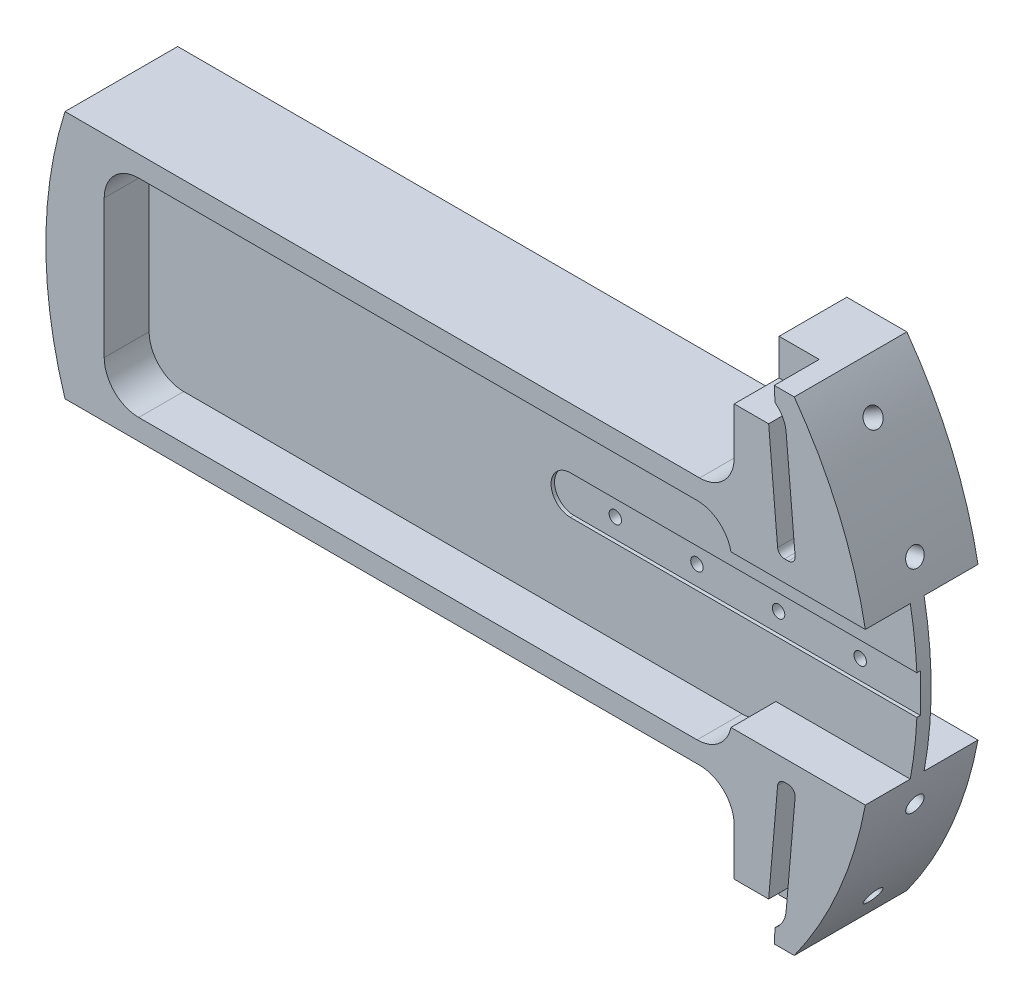
from build123d import *

# Parameters (mm, degrees)
BOSS_EXTRUDE1_DEPTH  = 2.54
BOSS_EXTRUDE2_DEPTH  = 8.255
SKETCH3_W            = 64.77
SKETCH3_H            = 7.1
CUT_EXTRUDE1_DEPTH   = 0.635
SKETCH4_R            = 1.143
CUT_EXTRUDE2_DEPTH   = 11.43
BOSS_EXTRUDE5_DEPTH  = 8.255
BOSS_EXTRUDE6_DEPTH  = 8.255
BOSS_EXTRUDE7_START  = -8.255
BOSS_EXTRUDE7_DEPTH  = 8.255
SKETCH39_W           = 13.975397925
SKETCH39_H           = 27.94
CUT_EXTRUDE19_DEPTH  = 8.255
FILLET2_R            = 1.27
SKETCH45_W           = 121.797556925
SKETCH45_H           = 2.54
BOSS_EXTRUDE8_DEPTH  = 10.795
SKETCH46_W           = 115.173424181
SKETCH46_H           = 40.351825118
CUT_EXTRUDE20_DEPTH  = 8.255
SKETCH48_W           = 115.173424181
SKETCH48_H           = 6.205912559
BOSS_EXTRUDE9_DEPTH  = 2.54
CUT_EXTRUDE24_DEPTH  = 43.688
CUT_EXTRUDE25_DEPTH  = 0.635
SKETCH53_W           = 13.339244652
SKETCH53_H           = 4.785328469
CUT_EXTRUDE26_DEPTH  = 43.688
BOSS_EXTRUDE10_REACH = 90.657
FILLET8_R            = 6.35
BOSS_EXTRUDE13_START = -20.701
BOSS_EXTRUDE13_DEPTH = 9.906
SKETCH63_R           = 1.651
CUT_EXTRUDE30_DEPTH  = 7.62
SKETCH64_R           = 1.651
CUT_EXTRUDE31_DEPTH  = 10.16
SKETCH65_R           = 1.651
CUT_EXTRUDE32_DEPTH  = 10.16
SKETCH66_R           = 1.651
CUT_EXTRUDE33_DEPTH  = 8.89
SKETCH67_R           = 1.651
CUT_EXTRUDE34_DEPTH  = 8.89


with BuildPart() as part:
    # Sketch1 → Boss-Extrude1 (new body)
    with BuildSketch(Plane.XY):
        with BuildLine():
            Line((-71.572584947, 25.4), (-65.222584947, 25.4))
            Line((-65.222584947, 25.4), (-65.222584947, 22.86))
            ThreePointArc((-65.222584947, 22.86), (-63.362713008, 18.369871939), (-58.872584947, 16.51))
            Line((-58.872584947, 16.51), (44.196, 16.51))
            ThreePointArc((44.196, 16.51), (48.686128061, 18.369871939), (50.546, 22.86))
            Line((50.546, 22.86), (50.546, 44.45))
            Line((50.546, 44.45), (61.579155694, 44.45))
            ThreePointArc((61.579155694, 44.45), (75.946, 0), (61.579155694, -44.45))
            Line((61.579155694, -44.45), (50.546, -44.45))
            Line((50.546, -44.45), (50.546, -22.86))
            ThreePointArc((50.546, -22.86), (48.686128061, -18.369871939), (44.196, -16.51))
            Line((44.196, -16.51), (-58.872584947, -16.51))
            ThreePointArc((-58.872584947, -16.51), (-63.362713008, -18.369871939), (-65.222584947, -22.86))
            Line((-65.222584947, -22.86), (-65.222584947, -25.4))
            Line((-65.222584947, -25.4), (-71.572584947, -25.4))
            ThreePointArc((-71.572584947, -25.4), (-75.946, 0), (-71.572584947, 25.4))
        make_face()
    extrude(amount=BOSS_EXTRUDE1_DEPTH)

    # Sketch2 → Boss-Extrude2 (add)
    with BuildSketch(Plane.XY.offset(2.54)):
        with BuildLine():
            Line((61.865268471, 17.78), (60.095110466, 38.1))
            ThreePointArc((60.095110466, 38.1), (59.464196764, 40.158289632), (58.047089349, 41.778911391))
            Line((58.047089349, 41.778911391), (57.900800643, 44.704))
            Line((57.900800643, 44.704), (61.395010384, 44.704))
            ThreePointArc((61.395010384, 44.704), (69.822038137, 29.877715884), (74.728381149, 13.544887112))
            Line((74.728381149, 13.544887112), (60.759450402, 13.544887112))
            Line((60.759450402, 13.544887112), (60.759450402, 15.094127876))
            ThreePointArc((60.759450402, 15.094127876), (61.639191639, 16.302501703), (61.865268471, 17.78))
        make_face()
        with BuildLine():
            Line((58.651639318, 17.500047669), (56.881481313, 37.820047669))
            Line((56.881481313, 37.820047669), (50.546, 37.820047669))
            Line((50.546, 37.820047669), (50.546, 16.566735288))
            Line((50.546, 16.566735288), (57.366094516, 16.566735288))
            ThreePointArc((57.366094516, 16.566735288), (58.160401987, 16.824667019), (58.651639318, 17.500047669))
        make_face()
        with BuildLine():
            Line((60.759450402, -13.544887112), (74.728381149, -13.544887112))
            ThreePointArc((74.728381149, -13.544887112), (69.822038137, -29.877715884), (61.395010384, -44.704))
            Line((61.395010384, -44.704), (57.900800643, -44.704))
            Line((57.900800643, -44.704), (58.047089349, -41.778911391))
            ThreePointArc((58.047089349, -41.778911391), (59.464196764, -40.158289632), (60.095110466, -38.1))
            Line((60.095110466, -38.1), (61.865268471, -17.78))
            ThreePointArc((61.865268471, -17.78), (61.639191639, -16.302501703), (60.759450402, -15.094127876))
            Line((60.759450402, -15.094127876), (60.759450402, -13.544887112))
        make_face()
        with BuildLine():
            Line((50.546, -16.566735288), (57.366094516, -16.566735288))
            ThreePointArc((57.366094516, -16.566735288), (58.160401987, -16.824667019), (58.651639318, -17.500047669))
            Line((58.651639318, -17.500047669), (56.881481313, -37.820047669))
            Line((56.881481313, -37.820047669), (50.546, -37.820047669))
            Line((50.546, -37.820047669), (50.546, -16.566735288))
        make_face()
    extrude(amount=BOSS_EXTRUDE2_DEPTH)

    # Sketch3 → Cut-Extrude1 (cut)
    with BuildSketch(Plane.XY.offset(2.54)):
        with Locations((44.577, 0)):
            Rectangle(SKETCH3_W, SKETCH3_H)
    extrude(amount=-CUT_EXTRUDE1_DEPTH, mode=Mode.SUBTRACT)

    # Sketch4 → Cut-Extrude2 (cut)
    with BuildSketch(Plane.XY.offset(1.905)):
        with Locations((19.812, 0)):
            Circle(SKETCH4_R)
        with Locations((34.812, 0)):
            Circle(SKETCH4_R)
        with Locations((49.812, 0)):
            Circle(SKETCH4_R)
        with Locations((64.812, 0)):
            Circle(SKETCH4_R)
    extrude(amount=-CUT_EXTRUDE2_DEPTH, mode=Mode.SUBTRACT)

    # Sketch19 → Boss-Extrude5 (add)
    with BuildSketch(Plane.XY.offset(2.54)):
        with BuildLine():
            Line((-71.572584947, -25.4), (-65.222584947, -25.4))
            Line((-65.222584947, -25.4), (-65.222584947, 25.4))
            Line((-65.222584947, 25.4), (-71.572584947, 25.4))
            ThreePointArc((-71.572584947, 25.4), (-75.946, 0), (-71.572584947, -25.4))
        make_face()
    extrude(amount=BOSS_EXTRUDE5_DEPTH)

    # Sketch33 → Boss-Extrude6 (add)
    with BuildSketch(Plane.XY.offset(2.54)):
        with BuildLine():
            Line((12.137284041, 16.51), (-58.872584947, 16.51))
            ThreePointArc((-58.872584947, 16.51), (-63.362713008, 18.369871939), (-65.222584947, 22.86))
            Line((-65.222584947, 22.86), (-65.222584947, 7.62))
            ThreePointArc((-65.222584947, 7.62), (-63.362713008, 12.110128061), (-58.872584947, 13.97))
            Line((-58.872584947, 13.97), (12.137284041, 13.97))
            Line((12.137284041, 13.97), (12.137284041, 16.51))
        make_face()
        with BuildLine():
            Line((12.137284041, -13.97), (12.137284041, -16.51))
            Line((12.137284041, -16.51), (-58.872584947, -16.51))
            ThreePointArc((-58.872584947, -16.51), (-63.362713008, -18.369871939), (-65.222584947, -22.86))
            Line((-65.222584947, -22.86), (-65.222584947, -7.62))
            ThreePointArc((-65.222584947, -7.62), (-63.362713008, -12.110128061), (-58.872584947, -13.97))
            Line((-58.872584947, -13.97), (12.137284041, -13.97))
        make_face()
    extrude(amount=BOSS_EXTRUDE6_DEPTH)

    # Sketch38 → Boss-Extrude7 (add)
    with BuildSketch(Plane.XY.offset(10.795).offset(BOSS_EXTRUDE7_START)):
        with BuildLine():
            Line((12.137284041, -13.97), (60.759450402, -13.97))
            Line((60.759450402, -13.97), (60.759450402, -15.094127876))
            ThreePointArc((60.759450402, -15.094127876), (61.639191639, -16.302501703), (61.865268471, -17.78))
            Line((61.865268471, -17.78), (58.298191457, -17.78))
            Line((58.298191457, -17.78), (50.546, -22.86))
            ThreePointArc((50.546, -22.86), (48.686128061, -18.369871939), (44.196, -16.51))
            Line((44.196, -16.51), (12.137284041, -16.51))
            Line((12.137284041, -16.51), (12.137284041, -13.97))
        make_face()
        with BuildLine():
            Line((61.865268471, 17.78), (58.298191457, 17.78))
            Line((58.298191457, 17.78), (50.546, 22.86))
            ThreePointArc((50.546, 22.86), (48.686128061, 18.369871939), (44.196, 16.51))
            Line((44.196, 16.51), (12.137284041, 16.51))
            Line((12.137284041, 16.51), (12.137284041, 13.97))
            Line((12.137284041, 13.97), (60.759450402, 13.97))
            Line((60.759450402, 13.97), (60.759450402, 15.094127876))
            ThreePointArc((60.759450402, 15.094127876), (61.639191639, 16.302501703), (61.865268471, 17.78))
        make_face()
    extrude(amount=BOSS_EXTRUDE7_DEPTH)

    # Sketch39 → Cut-Extrude19 (cut)
    with BuildSketch(Plane.XY.offset(10.795)):
        with Locations((67.747149365, 0)):
            Rectangle(SKETCH39_W, SKETCH39_H)
    extrude(amount=-CUT_EXTRUDE19_DEPTH, mode=Mode.SUBTRACT)

    # Fillet2
    fillet2_edges = [part.edges().sort_by_distance(p)[0] for p in [
        (58.627251529, -17.78, 6.6675),
        (58.627251529, 17.78, 6.6675),
        (61.865268471, 17.78, 6.6675),
        (61.865268471, -17.78, 6.6675),
    ]]
    fillet(fillet2_edges, radius=FILLET2_R)

    # Sketch45 → Boss-Extrude8 (add)
    with BuildSketch(Plane.XY.offset(10.795)):
        with Locations((-6.822240568, -21.445912559)):
            Rectangle(SKETCH45_W, SKETCH45_H)
        with Locations((-6.822240568, 21.445912559)):
            Rectangle(SKETCH45_W, SKETCH45_H)
    extrude(amount=-BOSS_EXTRUDE8_DEPTH)

    # Sketch46 → Cut-Extrude20 (cut)
    with BuildSketch(Plane.XY.offset(10.795)):
        with Locations((-7.635872857, 0)):
            Rectangle(SKETCH46_W, SKETCH46_H)
    extrude(amount=-CUT_EXTRUDE20_DEPTH, mode=Mode.SUBTRACT)

    # Sketch48 → Boss-Extrude9 (add)
    with BuildSketch(Plane.XY.offset(2.54)):
        with Locations((-7.635872857, 17.07295628)):
            Rectangle(SKETCH48_W, SKETCH48_H)
        with Locations((-7.635872857, -17.07295628)):
            Rectangle(SKETCH48_W, SKETCH48_H)
    extrude(amount=-BOSS_EXTRUDE9_DEPTH)

    # Sketch51 → Cut-Extrude24 (cut)
    with BuildSketch(Plane.XY.offset(10.795)):
        Polygon((-80.776388958, 25.4), (-80.776388958, 22.715912559), (-65.222584947, 22.715912559), (50.546, 22.715912559), (50.546, 25.4), (-65.222584947, 25.4), align=None)
        Polygon((50.546, -22.715912559), (-65.222584947, -22.715912559), (-80.776388958, -22.715912559), (-80.776388958, -25.4), (-65.222584947, -25.4), (50.546, -25.4), align=None)
    extrude(amount=-CUT_EXTRUDE24_DEPTH, mode=Mode.SUBTRACT)

    # Sketch52 → Cut-Extrude25 (cut)
    with BuildSketch(Plane.XY.offset(2.54)):
        with BuildLine():
            Line((12.192, -3.55), (12.192, 3.55))
            ThreePointArc((12.192, 3.55), (8.642, 0), (12.192, -3.55))
        make_face()
    extrude(amount=-CUT_EXTRUDE25_DEPTH, mode=Mode.SUBTRACT)

    # Sketch53 → Cut-Extrude26 (cut)
    with BuildSketch(Plane(origin=(0, 0, 0), x_dir=(-1, 0, 0), z_dir=(0, 0, -1))):
        with Locations((-57.215622326, -46.842664235)):
            Rectangle(SKETCH53_W, SKETCH53_H)
        with Locations((-57.215622326, 46.842664235)):
            Rectangle(SKETCH53_W, SKETCH53_H)
    extrude(amount=-CUT_EXTRUDE26_DEPTH, mode=Mode.SUBTRACT)

    # Boss-Extrude10: up to this face of the body (flat: up to its plane)
    boss_extrude10_end = Plane(part.part.faces().sort_by_distance((5.813884526, 0, 0))[0])
    # Sketch58 → Boss-Extrude10 (add, up to the picked face)
    with BuildSketch(Plane.XY.offset(10.795), mode=Mode.PRIVATE) as boss_extrude10_sk1:
        with BuildLine():
            Line((50.546, 22.86), (-72.423858748, 22.86))
            ThreePointArc((-72.423858748, 22.86), (-72.446555826, 22.787967547), (-72.469181261, 22.715912559))
            Line((-72.469181261, 22.715912559), (-65.222584947, 22.715912559))
            Line((-65.222584947, 22.715912559), (-65.222584947, 19.05))
            Line((-65.222584947, 19.05), (50.546, 19.05))
            Line((50.546, 19.05), (50.546, 22.86))
        make_face()
    boss_extrude10_tool1 = split(extrude(boss_extrude10_sk1.sketch, amount=-BOSS_EXTRUDE10_REACH, mode=Mode.PRIVATE), bisect_by=boss_extrude10_end, keep=Keep.BOTH, mode=Mode.PRIVATE)
    # Sketch58 → Boss-Extrude10 (add, up to the picked face)
    with BuildSketch(Plane.XY.offset(10.795), mode=Mode.PRIVATE) as boss_extrude10_sk2:
        with BuildLine():
            Line((-65.222584947, -22.715912559), (-65.222584947, -19.05))
            Line((-65.222584947, -19.05), (50.546, -19.05))
            Line((50.546, -19.05), (50.546, -22.86))
            Line((50.546, -22.86), (-72.423858748, -22.86))
            ThreePointArc((-72.423858748, -22.86), (-72.446555826, -22.787967547), (-72.469181261, -22.715912559))
            Line((-72.469181261, -22.715912559), (-65.222584947, -22.715912559))
        make_face()
    boss_extrude10_tool2 = split(extrude(boss_extrude10_sk2.sketch, amount=-BOSS_EXTRUDE10_REACH, mode=Mode.PRIVATE), bisect_by=boss_extrude10_end, keep=Keep.BOTH, mode=Mode.PRIVATE)
    add(boss_extrude10_tool1.solids().sort_by(Axis((-7.483073, 20.959315, 10.795), (0, 0, -1)))[0])
    add(boss_extrude10_tool2.solids().sort_by(Axis((-7.483073, -20.959315, 10.795), (0, 0, -1)))[0])

    # Fillet8
    # the kernel refuses this fillet: 6.35 mm, written as the material it adds along each edge
    with BuildSketch(Plane(origin=(50.546, 22.86, 10.795), x_dir=(-1, 0, 0), z_dir=(0, 0, -1))) as fillet8_piece_1:
        with BuildLine():
            CenterArc((FILLET8_R, FILLET8_R), FILLET8_R, 180, 90)
            Line((0, FILLET8_R), (-FILLET8_R * 0.02, FILLET8_R))
            Line((-FILLET8_R * 0.02, FILLET8_R), (-FILLET8_R * 0.02, -FILLET8_R * 0.02))
            Line((-FILLET8_R * 0.02, -FILLET8_R * 0.02), (FILLET8_R, -FILLET8_R * 0.02))
            Line((FILLET8_R, -FILLET8_R * 0.02), (FILLET8_R, 0))
        make_face()
    extrude(amount=10.795)
    with BuildSketch(Plane(origin=(50.546, -22.86, 10.795), x_dir=(-1, 0, 0), z_dir=(0, 0, -1))) as fillet8_piece_2:
        with BuildLine():
            CenterArc((FILLET8_R, -FILLET8_R), FILLET8_R, 90, 90)
            Line((0, -FILLET8_R), (-FILLET8_R * 0.02, -FILLET8_R))
            Line((-FILLET8_R * 0.02, -FILLET8_R), (-FILLET8_R * 0.02, FILLET8_R * 0.02))
            Line((-FILLET8_R * 0.02, FILLET8_R * 0.02), (FILLET8_R, FILLET8_R * 0.02))
            Line((FILLET8_R, FILLET8_R * 0.02), (FILLET8_R, 0))
        make_face()
    extrude(amount=10.795)
    with BuildSketch(Plane(origin=(49.950839234, 19.05, 2.54), x_dir=(-1, 0, 0), z_dir=(0, 0, 1))) as fillet8_piece_3:
        with BuildLine():
            CenterArc((6.221703947, 6.35), FILLET8_R, 191.536959033, 78.463040967)
            Line((0, 5.08), (-0.124434079, 5.0546))
            ThreePointArc((-0.124434079, 5.0546), (-0.127, 2.54), (-0.127, 0))
            Line((-0.127, 0), (0, -0.127))
            Line((0, -0.127), (6.221703947, -0.127))
            Line((6.221703947, -0.127), (6.221703947, 0))
        make_face()
    extrude(amount=8.255)
    with BuildSketch(Plane(origin=(49.950839234, -19.05, 2.54), x_dir=(-1.5777405628683923e-12, 1.0, 0), z_dir=(0, 0, 1))) as fillet8_piece_4:
        with BuildLine():
            CenterArc((6.35, 6.221703947), FILLET8_R, 180, 78.463040967)
            Line((0, 6.221703947), (-0.127, 6.221703947))
            Line((-0.127, 6.221703947), (-0.127, 0))
            Line((-0.127, 0), (0, -0.127))
            ThreePointArc((0, -0.127), (2.54, -0.127), (5.0546, -0.124434079))
            Line((5.0546, -0.124434079), (5.08, 0))
        make_face()
    extrude(amount=8.255)
    with BuildSketch(Plane(origin=(-65.222584947, 19.05, 10.795), x_dir=(0, -1, 0), z_dir=(0, 0, -1)), Plane(origin=(-65.222584947, -19.05, 10.795), x_dir=(1, 0, 0), z_dir=(0, 0, -1))) as fillet8_piece_5:
        with BuildLine():
            CenterArc((FILLET8_R, -FILLET8_R), FILLET8_R, 90, 90)
            Line((0, -FILLET8_R), (-FILLET8_R * 0.02, -FILLET8_R))
            Line((-FILLET8_R * 0.02, -FILLET8_R), (-FILLET8_R * 0.02, FILLET8_R * 0.02))
            Line((-FILLET8_R * 0.02, FILLET8_R * 0.02), (FILLET8_R, FILLET8_R * 0.02))
            Line((FILLET8_R, FILLET8_R * 0.02), (FILLET8_R, 0))
        make_face()
    extrude(amount=8.255)

    # Sketch59 → Boss-Extrude13 (add)
    with BuildSketch(Plane.XY.offset(10.795).offset(BOSS_EXTRUDE13_START)):
        with BuildLine():
            Line((50.546, -29.21), (50.546, -44.45))
            Line((50.546, -44.45), (61.579155694, -44.45))
            ThreePointArc((61.579155694, -44.45), (69.79870034, -29.932195824), (74.650077133, -13.97))
            Line((74.650077133, -13.97), (49.950839234, -13.97))
            ThreePointArc((49.950839234, -13.97), (47.745227916, -17.61868885), (43.729135287, -19.05))
            Line((43.729135287, -19.05), (-58.872584947, -19.05))
            ThreePointArc((-58.872584947, -19.05), (-63.362713008, -17.190128061), (-65.222584947, -12.7))
            Line((-65.222584947, -12.7), (-65.222584947, 12.7))
            ThreePointArc((-65.222584947, 12.7), (-63.362713008, 17.190128061), (-58.872584947, 19.05))
            Line((-58.872584947, 19.05), (43.729135287, 19.05))
            ThreePointArc((43.729135287, 19.05), (47.745227916, 17.61868885), (49.950839234, 13.97))
            Line((49.950839234, 13.97), (74.650077133, 13.97))
            ThreePointArc((74.650077133, 13.97), (69.79870034, 29.932195824), (61.579155694, 44.45))
            Line((61.579155694, 44.45), (50.546, 44.45))
            Line((50.546, 44.45), (50.546, 29.21))
            ThreePointArc((50.546, 29.21), (48.686128061, 24.719871939), (44.196, 22.86))
            Line((44.196, 22.86), (-72.423858748, 22.86))
            ThreePointArc((-72.423858748, 22.86), (-75.946, 0), (-72.423858748, -22.86))
            Line((-72.423858748, -22.86), (44.196, -22.86))
            ThreePointArc((44.196, -22.86), (48.686128061, -24.719871939), (50.546, -29.21))
        make_face()
    extrude(amount=BOSS_EXTRUDE13_DEPTH)

    # Sketch63 → Cut-Extrude30 (cut)
    with BuildSketch(Plane(origin=(65.771165316, 37.973, 0), x_dir=(0, 0, -1), z_dir=(0.866025403784438, 0.5000000000000012, 0))):
        with Locations(Location((-0.4445, 0.085251351, 0), (0, 0, 90))):
            Circle(SKETCH63_R)
    cut_extrude30 = extrude(amount=-CUT_EXTRUDE30_DEPTH, mode=Mode.SUBTRACT)

    # Sketch64 → Cut-Extrude31 (cut)
    with BuildSketch(Plane(origin=(73.358202803, 19.656271199, 0), x_dir=(0, 0, -1), z_dir=(0.9659258262890681, 0.2588190451025213, 0))):
        with Locations(Location((-0.381, 0.015122113, 0), (0, 0, 90))):
            Circle(SKETCH64_R)
    cut_extrude31 = extrude(amount=-CUT_EXTRUDE31_DEPTH, mode=Mode.SUBTRACT)

    # Mirror1: Cut-Extrude30, Cut-Extrude31 across plane
    add(cut_extrude30.mirror(Plane.ZX), mode=Mode.SUBTRACT)
    add(cut_extrude31.mirror(Plane.ZX), mode=Mode.SUBTRACT)

    # Sketch65 → Cut-Extrude32 (cut)
    with BuildSketch(Plane.ZY.offset(75.946)):
        with Locations((0.508, 0)):
            Circle(SKETCH65_R)
    extrude(amount=-CUT_EXTRUDE32_DEPTH, mode=Mode.SUBTRACT)

    # Sketch66 → Cut-Extrude33 (cut)
    with BuildSketch(Plane(origin=(-73.358202803, -19.656271199, 0), x_dir=(0, 0, 1), z_dir=(-0.9659258262890681, -0.2588190451025213, 0))):
        with Locations(Location((0.508, -0.034390425, 0), (0, 0, 270))):
            Circle(SKETCH66_R)
    extrude(amount=-CUT_EXTRUDE33_DEPTH, mode=Mode.SUBTRACT)

    # Sketch67 → Cut-Extrude34 (cut)
    with BuildSketch(Plane(origin=(-73.358202803, 19.656271199, 0), x_dir=(0, 0, 1), z_dir=(-0.9659258262890681, 0.2588190451025213, 0))):
        with Locations(Location((0.508, 0, 0), (0, 0, 270))):
            Circle(SKETCH67_R)
    extrude(amount=-CUT_EXTRUDE34_DEPTH, mode=Mode.SUBTRACT)


solid = part.part
